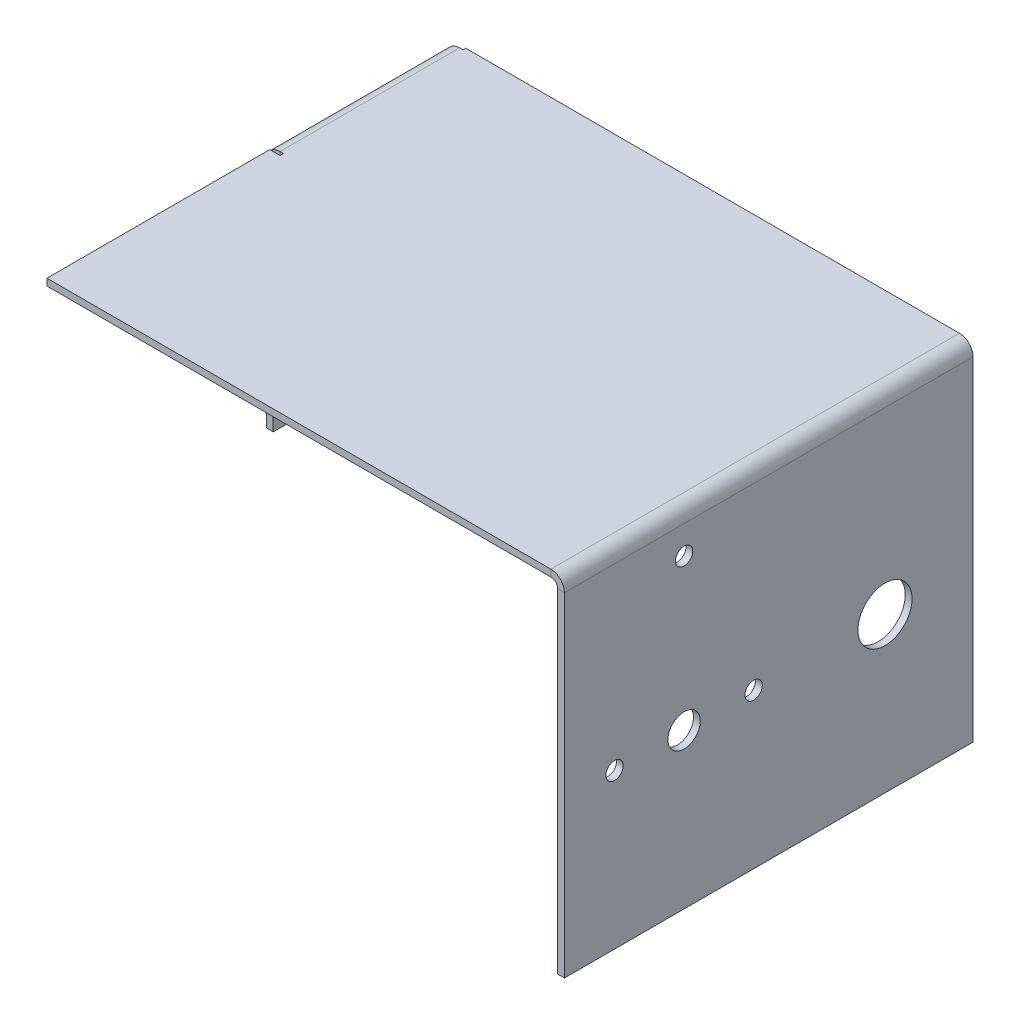
from build123d import *

# Parameters (mm, degrees)
SKETCH1_W                     = 75
SKETCH1_H                     = 60
BASE_FLANGE1_DEPTH            = 1
EDGE_FLANGE1_STRIP_W          = 6
EDGE_FLANGE1_STRIP_H          = 1
EDGE_FLANGE1_STRIP_CUT_DEPTH  = 60
EDGE_FLANGE1_DEPTH            = 60
EDGE_FLANGE3_STRIP_W          = 6
EDGE_FLANGE3_STRIP_H          = 1
EDGE_FLANGE3_STRIP_CUT_DEPTH  = 26.369340124
EDGE_FLANGE3_RELIEF_W         = 6.5
EDGE_FLANGE3_RELIEF_H         = 0.5
EDGE_FLANGE3_RELIEF_CUT_DEPTH = 1
EDGE_FLANGE3_DEPTH            = 26.369340124
SKETCH15_R                    = 1.27
SKETCH15_R_2                  = 2.3749
SKETCH15_R_3                  = 3.975
CUT_EXTRUDE4_DEPTH            = 98.10818709


# Sheet-metal steps are written as plain solids
with BuildPart() as part:
    # Sketch1 → Base-Flange1 (new body)
    with BuildSketch(Plane(origin=(0, 0, 0), x_dir=(1, 0, 0), z_dir=(0, 1, 0))):
        Rectangle(SKETCH1_W, SKETCH1_H)
    extrude(amount=-BASE_FLANGE1_DEPTH)

    # Edge-Flange1 strip (across the edge) → Edge-Flange1 strip cut (cut)
    with BuildSketch(Plane(origin=(37.5, -1, -30), x_dir=(-1, 0, 0), z_dir=(0, 0, 1))):
        with Locations((-2, -0.5)):
            Rectangle(EDGE_FLANGE1_STRIP_W, EDGE_FLANGE1_STRIP_H)
    extrude(amount=EDGE_FLANGE1_STRIP_CUT_DEPTH, mode=Mode.SUBTRACT)

    # Edge-Flange1 section (across the edge) → Edge-Flange1 (add)
    with BuildSketch(Plane(origin=(37.5, -1, -30), x_dir=(-1, 0, 0), z_dir=(0, 0, 1))):
        with BuildLine():
            Line((-1, 1), (-1, 50))
            Line((-1, 50), (0, 50))
            Line((0, 50), (0, 1))
            ThreePointArc((0, 1), (0.292893219, 0.292893219), (1, 0))
            Line((1, 0), (1, -1))
            ThreePointArc((1, -1), (-0.414213562, -0.414213562), (-1, 1))
        make_face()
    extrude(amount=EDGE_FLANGE1_DEPTH)

    # Edge-Flange3 strip (across the edge) → Edge-Flange3 strip cut (cut)
    with BuildSketch(Plane(origin=(-37.5, -1, -3.224868286), x_dir=(1, 0, 0), z_dir=(0, 0, -1))):
        with Locations((-2, -0.5)):
            Rectangle(EDGE_FLANGE3_STRIP_W, EDGE_FLANGE3_STRIP_H)
    extrude(amount=EDGE_FLANGE3_STRIP_CUT_DEPTH, mode=Mode.SUBTRACT)

    # Edge-Flange3 relief (on the sheet) → Edge-Flange3 relief cut (cut)
    with BuildSketch(Plane(origin=(-36.5, -1, -3.224868286), x_dir=(1, 0, 0), z_dir=(0, -1, 0))):
        with Locations((-2.75, 0.25)):
            Rectangle(EDGE_FLANGE3_RELIEF_W, EDGE_FLANGE3_RELIEF_H)
        with Locations((-2.75, -26.619340124)):
            Rectangle(EDGE_FLANGE3_RELIEF_W, EDGE_FLANGE3_RELIEF_H)
    extrude(amount=-EDGE_FLANGE3_RELIEF_CUT_DEPTH, mode=Mode.SUBTRACT)

    # Edge-Flange3 section (across the edge) → Edge-Flange3 (add)
    with BuildSketch(Plane(origin=(-37.5, -1, -3.224868286), x_dir=(1, 0, 0), z_dir=(0, 0, -1))):
        with BuildLine():
            Line((-1, 1), (-1, 35.1591326))
            Line((-1, 35.1591326), (0, 35.1591326))
            Line((0, 35.1591326), (0, 1))
            ThreePointArc((0, 1), (0.292893219, 0.292893219), (1, 0))
            Line((1, 0), (1, -1))
            ThreePointArc((1, -1), (-0.414213562, -0.414213562), (-1, 1))
        make_face()
    extrude(amount=EDGE_FLANGE3_DEPTH)

    # Sketch15 → Cut-Extrude4 (cut, through all)
    with BuildSketch(Plane(origin=(38.5, 0, 0), x_dir=(0, 0, -1), z_dir=(1, 0, 0))):
        with Locations(Location((-22.64162, -28.28773, 0), (0, 0, 90))):
            Circle(SKETCH15_R)
        with Locations(Location((-12.43082, -28.28773, 0), (0, 0, 90))):
            Circle(SKETCH15_R_2)
        with Locations(Location((-2.22002, -28.28773, 0), (0, 0, 90))):
            Circle(SKETCH15_R)
        with Locations(Location((-12.43082, -6.11353, 0), (0, 0, 90))):
            Circle(SKETCH15_R)
        with Locations(Location((17.06918, -28.28773, 0), (0, 0, 90))):
            Circle(SKETCH15_R_3)
    extrude(amount=-CUT_EXTRUDE4_DEPTH, mode=Mode.SUBTRACT)


solid = part.part
